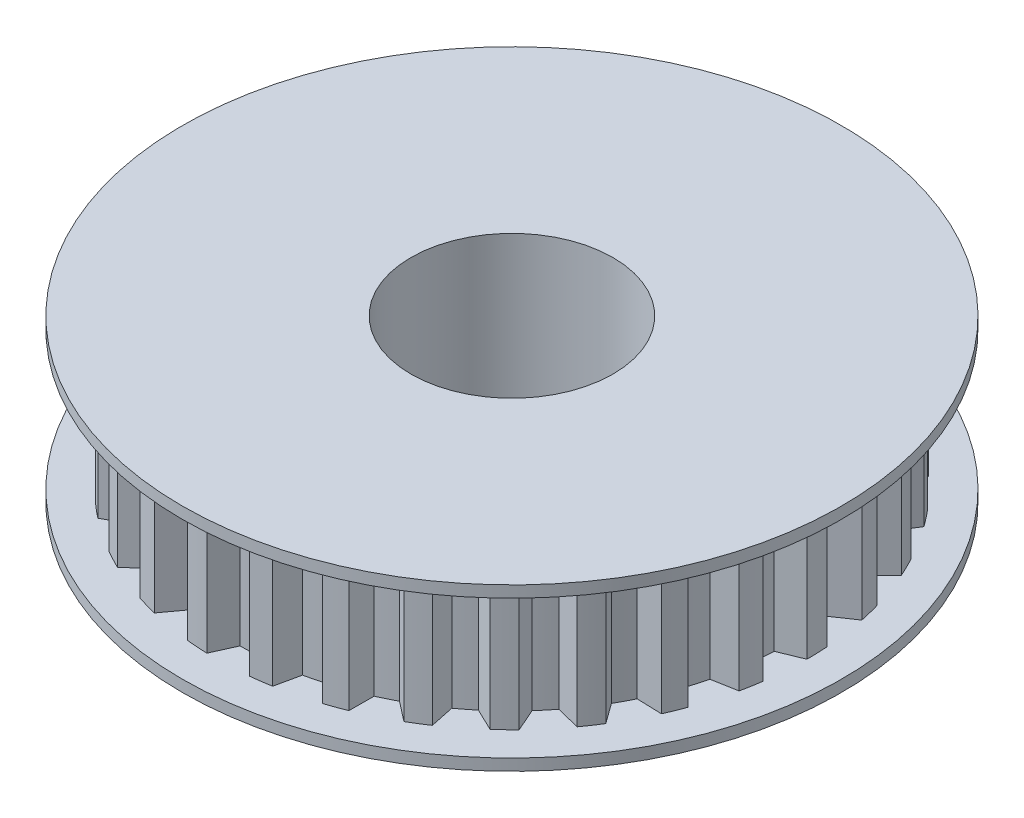
from build123d import *

# Parameters (mm, degrees)
SKETCH1_R           = 28.575
BOSS_EXTRUDE1_DEPTH = 1
BOSS_EXTRUDE3_DEPTH = 12
CIRPATTERN2_COUNT   = 30
SKETCH3_R           = 28.575
BOSS_EXTRUDE4_DEPTH = 1
CUT_EXTRUDE1_REACH  = 44.768
SKETCH4_R           = 8.75859163


with BuildPart() as part:
    # Sketch1 → Boss-Extrude1 (new body)
    with BuildSketch(Plane(origin=(0, 0, 0), x_dir=(1, 0, 0), z_dir=(0, 1, 0))):
        Circle(SKETCH1_R)
    extrude(amount=BOSS_EXTRUDE1_DEPTH)

    # Sketch2 → Boss-Extrude3 (add)
    with BuildSketch(Plane(origin=(0, 1, 0), x_dir=(1, 0, 0), z_dir=(0, 1, 0))):
        with BuildLine():
            Line((0, 0), (25.575, 0))
            ThreePointArc((25.575, 0), (25.559420401, 0.892554628), (25.512700585, 1.784021816))
            Line((25.512700585, 1.784021816), (23.445853683, 2.464258522))
            ThreePointArc((23.445853683, 2.464258522), (23.345569721, 3.281005855), (23.216842777, 4.093755788))
            Line((23.216842777, 4.093755788), (25.016124889, 5.317341493))
            Line((25.016124889, 5.317341493), (0, 0))
        make_face()
    boss_extrude3 = extrude(amount=BOSS_EXTRUDE3_DEPTH)

    # CirPattern2: Boss-Extrude3 ×30 about axis
    cirpattern2_axis = Axis((0, 1, 0), (0, -1, 0))
    for i in range(1, CIRPATTERN2_COUNT):
        add(boss_extrude3.rotate(cirpattern2_axis, i * 360 / CIRPATTERN2_COUNT))

    # Sketch3 → Boss-Extrude4 (add)
    with BuildSketch(Plane(origin=(0, 13, 0), x_dir=(1, 0, 0), z_dir=(0, 1, 0))):
        Circle(SKETCH3_R)
    extrude(amount=BOSS_EXTRUDE4_DEPTH)

    # Sketch4 → Cut-Extrude1 (cut, up to next)
    with BuildSketch(Plane(origin=(0, 14, 0), x_dir=(1, 0, 0), z_dir=(0, 1, 0)), mode=Mode.PRIVATE) as cut_extrude1_sk1:
        Circle(SKETCH4_R)
    cut_extrude1_tool1 = extrude(cut_extrude1_sk1.sketch, amount=-CUT_EXTRUDE1_REACH, mode=Mode.PRIVATE) & part.part
    add(cut_extrude1_tool1.solids().sort_by_distance((0, 14, 0))[0], mode=Mode.SUBTRACT)


solid = part.part
